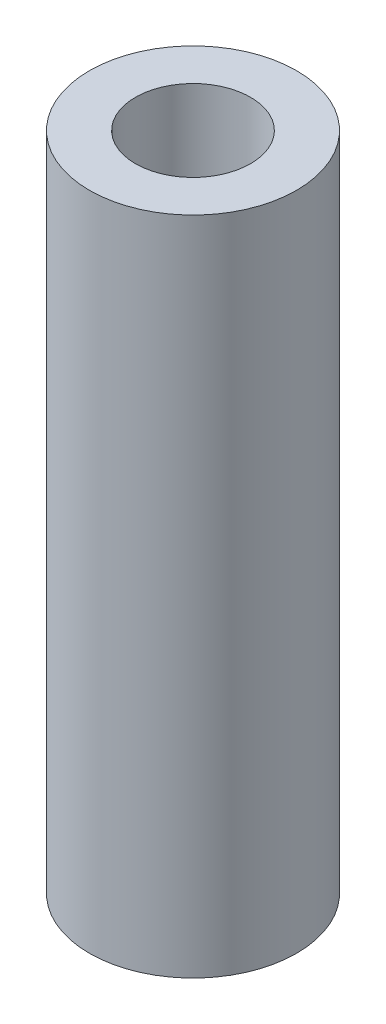
from build123d import *

# Parameters (mm, degrees)
SKETCH1_R           = 5.715
SKETCH1_R_2         = 3.175
BOSS_EXTRUDE1_DEPTH = 18.2245


with BuildPart() as part:
    # Sketch1 → Boss-Extrude1 (new, symmetric)
    with BuildSketch(Plane(origin=(0, 0, 0), x_dir=(1, 0, 0), z_dir=(0, 1, 0))):
        Circle(SKETCH1_R)
        Circle(SKETCH1_R_2, mode=Mode.SUBTRACT)
    extrude(amount=BOSS_EXTRUDE1_DEPTH, both=True)


solid = part.part
